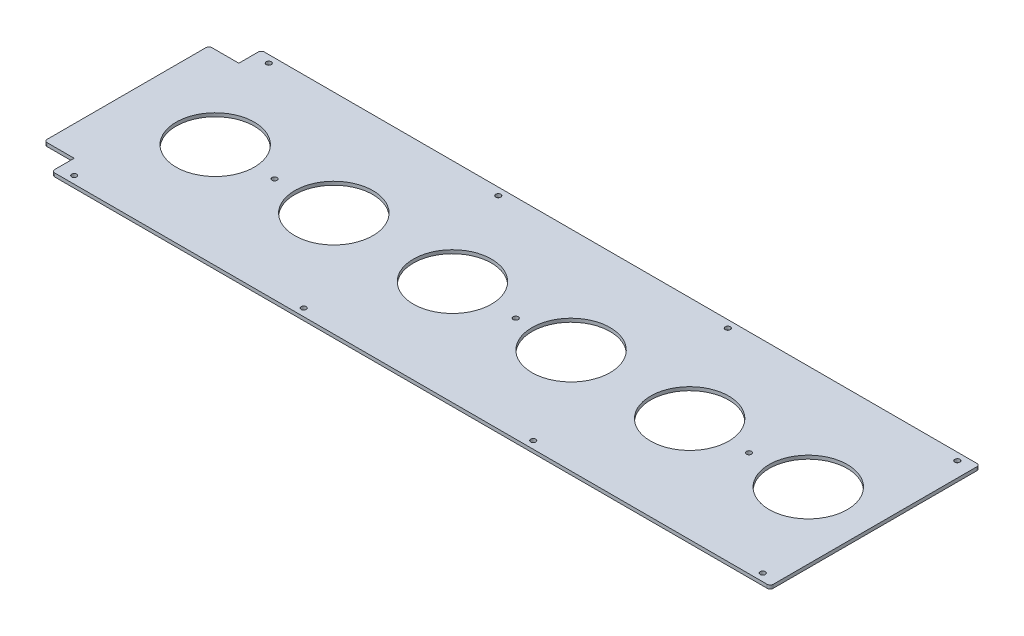
from build123d import *

# Parameters (mm, degrees)
SKETCH1_R             = 33.147
BOSS_EXTRUDE1_DEPTH   = 2.9718
F_8_CLEARANCE_HOLE1_D = 4.3053
FILLET1_R             = 2.54


with BuildPart() as part:
    # Sketch1 → Boss-Extrude1 (new body)
    with BuildSketch(Plane(origin=(0, 0, 0), x_dir=(1, 0, 0), z_dir=(0, 1, 0))):
        Polygon((720.939652548, 26.242162499), (720.939652548, -113.457837501), (746.339652548, -113.457837501), (746.339652548, -132.507837501), (1355.939652548, -132.507837501), (1355.939652548, 45.292162499), (746.339652548, 45.292162499), (746.339652548, 26.242162499), align=None)
        with Locations((1299.335652548, -43.607837501)):
            Circle(SKETCH1_R, mode=Mode.SUBTRACT)
        with Locations((1198.700852548, -43.607837501)):
            Circle(SKETCH1_R, mode=Mode.SUBTRACT)
        with Locations((1098.066052548, -43.607837501)):
            Circle(SKETCH1_R, mode=Mode.SUBTRACT)
        with Locations((997.431252548, -43.607837501)):
            Circle(SKETCH1_R, mode=Mode.SUBTRACT)
        with Locations((896.796452548, -43.607837501)):
            Circle(SKETCH1_R, mode=Mode.SUBTRACT)
        with Locations((796.161652548, -43.607837501)):
            Circle(SKETCH1_R, mode=Mode.SUBTRACT)
    extrude(amount=BOSS_EXTRUDE1_DEPTH)

    # #8 Clearance Hole1 (through all)
    with Locations(Plane(origin=(0, 2.9718, 0), x_dir=(1, 0, 0), z_dir=(0, 1, 0))):
        with Locations((759.039652548, 38.942162499), (759.039652548, -126.157837501), (953.772985881, -126.157837501), (953.772985881, 38.942162499), (1148.506319214, 38.942162499), (1148.506319214, -126.157837501), (1343.239652548, -126.157837501), (1343.239652548, 38.942162499), (1249.018252548, -43.607837501), (1051.139652548, -43.607837501), (846.479052548, -43.607837501)):
            Hole(F_8_CLEARANCE_HOLE1_D / 2)

    # Fillet1
    fillet1_edges = [part.edges().sort_by_distance(p)[0] for p in [
        (720.939652548, 1.4859, 113.457837501),
        (720.939652548, 1.4859, -26.242162499),
        (746.339652548, 1.4859, -45.292162499),
        (746.339652548, 1.4859, 132.507837501),
        (1355.939652548, 1.4859, 132.507837501),
        (1355.939652548, 1.4859, -45.292162499),
    ]]
    fillet(fillet1_edges, radius=FILLET1_R)


solid = part.part
